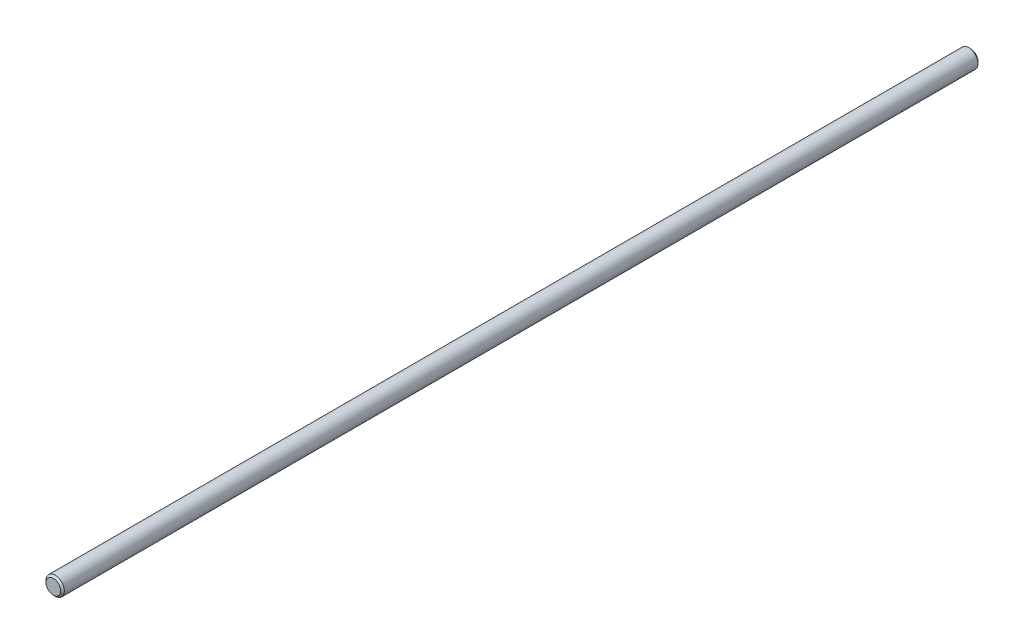
from build123d import *

# Parameters (mm, degrees)
ESBO_O1_R                = 2.5
RESSALTO_EXTRUS_O1_DEPTH = 250
CHANFRO1_SIZE            = 0.5


with BuildPart() as part:
    # Esboço1 → Ressalto-extrusão1 (new body)
    with BuildSketch(Plane.XY):
        Circle(ESBO_O1_R)
    extrude(amount=RESSALTO_EXTRUS_O1_DEPTH)

    # Chanfro1
    chanfro1_edges = [part.edges().sort_by_distance(p)[0] for p in [
        (-2.5, 0, 0),
        (-2.5, 0, 250),
    ]]
    chamfer(chanfro1_edges, length=CHANFRO1_SIZE)


solid = part.part
